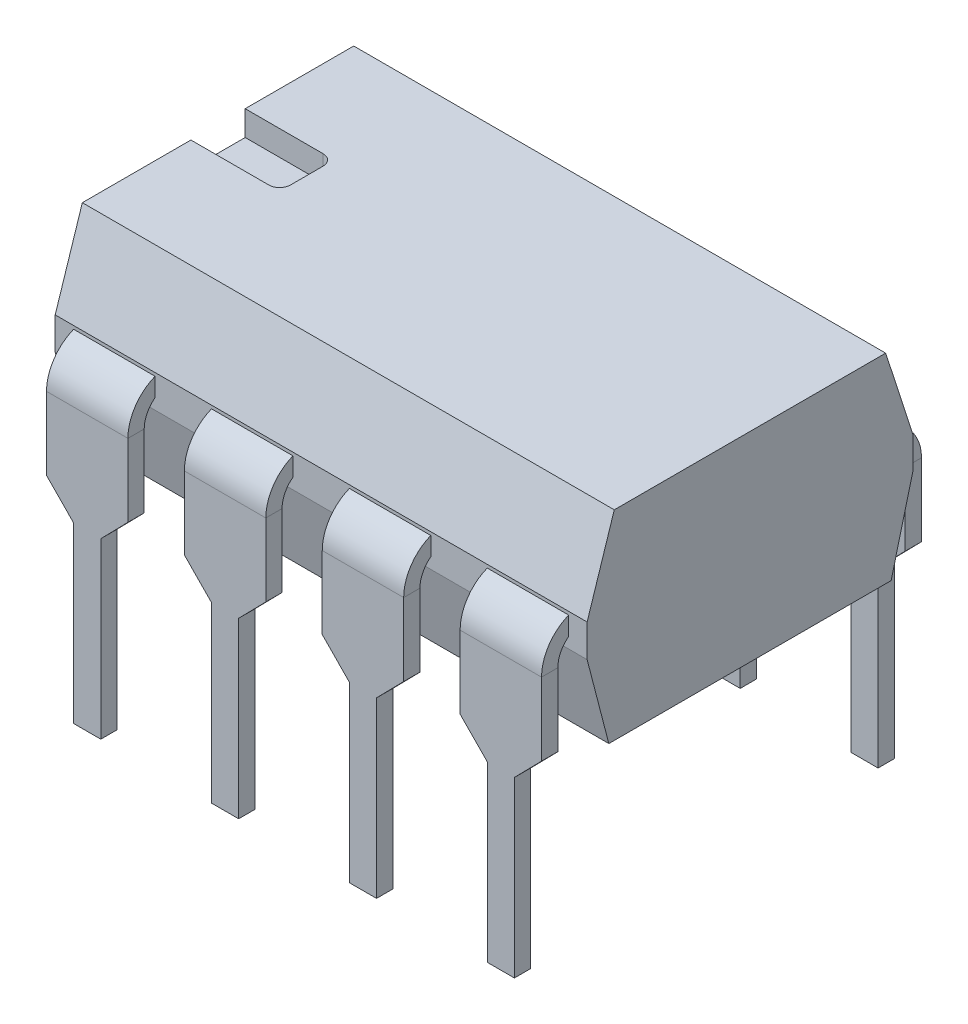
from build123d import *

# Parameters (mm, degrees)
BODY_FEATURE_DEPTH                    = 1.84
BODY_FEATURE_DEPTH_BACK               = 1.84
SKETCH1_W                             = 9.8
SKETCH1_H                             = 6
BEVEL_FEATURE_DEPTH                   = 9.8
BEVEL_FEATURE_DEPTH_BACK              = 9.8
SIGN_FEATURE_DEPTH                    = 0.46
FIRST_AND_LAST_PIN_FEATURE_DEPTH      = 0.75
FIRST_AND_LAST_PIN_FEATURE_DEPTH_BACK = 0.75
PIN_PROFILE_FEATURE_DEPTH             = 10
PIN_PROFILE_FEATURE_DEPTH_BACK        = 10
OTHER_PINS_FEATURE_COUNT              = 4
OTHER_PINS_FEATURE_PITCH              = 2.54


# Sheet-metal steps are written as plain solids
with BuildPart() as part:
    # Sketch1 → Body Feature (new, two sides: drawn at the far end of the back side and taken through both)
    with BuildSketch(Plane(origin=(0, 2.5, 0), x_dir=(1, 0, 0), z_dir=(0, 1, 0)).offset(-BODY_FEATURE_DEPTH_BACK)):
        with Locations((3.81, 3.5)):
            Rectangle(SKETCH1_W, SKETCH1_H)
    extrude(amount=BODY_FEATURE_DEPTH + BODY_FEATURE_DEPTH_BACK)

    # Sketch2 → Bevel Feature (cut, two sides: drawn at the far end of the back side and taken through both)
    with BuildSketch(Plane(origin=(0, 0, 0), x_dir=(0, 0, -1), z_dir=(1, 0, 0)).offset(-BEVEL_FEATURE_DEPTH_BACK)):
        Polygon((-9.5, 4.382711437), (-6.267114103, 14.34), (13.267114103, 14.34), (16.5, 4.382711437), (16.5, 0.922493794), (13.834417196, -9.34), (-6.834417196, -9.34), (-9.5, 0.922493794), align=None)
        Polygon((0.5, 2.8), (1, 4.34), (6, 4.34), (6.5, 2.8), (6.5, 2.2), (6.1, 0.66), (0.9, 0.66), (0.5, 2.2), align=None, mode=Mode.SUBTRACT)
    extrude(amount=BEVEL_FEATURE_DEPTH + BEVEL_FEATURE_DEPTH_BACK, mode=Mode.SUBTRACT)

    # Sketch3 → Sign Feature (cut)
    with BuildSketch(Plane(origin=(0, 4.34, 0), x_dir=(1, 0, 0), z_dir=(0, 1, 0))):
        with BuildLine():
            Line((-1.435, 4), (0.345, 4))
            ThreePointArc((0.345, 4), (0.486421356, 3.941421356), (0.545, 3.8))
            Line((0.545, 3.8), (0.545, 3.2))
            ThreePointArc((0.545, 3.2), (0.486421356, 3.058578644), (0.345, 3))
            Line((0.345, 3), (-1.435, 3))
            ThreePointArc((-1.435, 3), (-1.576421356, 3.058578644), (-1.635, 3.2))
            Line((-1.635, 3.2), (-1.635, 3.8))
            ThreePointArc((-1.635, 3.8), (-1.576421356, 3.941421356), (-1.435, 4))
        make_face()
    extrude(amount=-SIGN_FEATURE_DEPTH, mode=Mode.SUBTRACT)


with BuildPart() as body_2:
    # Sketch4 → First and Last Pin Feature (new, two sides: drawn at the far end of the back side and taken through both)
    with BuildSketch(Plane(origin=(0, 0, 0), x_dir=(0, 0, -1), z_dir=(1, 0, 0)).offset(-FIRST_AND_LAST_PIN_FEATURE_DEPTH_BACK)):
        with BuildLine():
            Line((0, -3.05), (0, 2))
            ThreePointArc((0, 2), (0.234314575, 2.565685425), (0.8, 2.8))
            Line((0.8, 2.8), (6.2, 2.8))
            ThreePointArc((6.2, 2.8), (6.765685425, 2.565685425), (7, 2))
            Line((7, 2), (7, -3.05))
            Line((7, -3.05), (6.7, -3.05))
            Line((6.7, -3.05), (6.7, 2))
            ThreePointArc((6.7, 2), (6.553553391, 2.353553391), (6.2, 2.5))
            Line((6.2, 2.5), (0.8, 2.5))
            ThreePointArc((0.8, 2.5), (0.446446609, 2.353553391), (0.3, 2))
            Line((0.3, 2), (0.3, -3.05))
            Line((0.3, -3.05), (0, -3.05))
        make_face()
    extrude(amount=FIRST_AND_LAST_PIN_FEATURE_DEPTH + FIRST_AND_LAST_PIN_FEATURE_DEPTH_BACK)

    # Sketch9 → Pin Profile Feature (cut, two sides: drawn at the far end of the back side and taken through both)
    with BuildSketch(Plane.XY.offset(-PIN_PROFILE_FEATURE_DEPTH_BACK)):
        Polygon((-0.25, -3.05), (-0.25, 0.15), (-0.75, 0.66), (-0.75, -4.05), (0.75, -4.05), (0.75, 0.66), (0.25, 0.15), (0.25, -3.05), align=None)
    extrude(amount=PIN_PROFILE_FEATURE_DEPTH + PIN_PROFILE_FEATURE_DEPTH_BACK, mode=Mode.SUBTRACT)


with BuildPart() as other_pins_feature_1:
    # Other Pins Feature: pattern copy
    add(body_2.part.moved(Location(Vector(1, 0, 0) * (1 * OTHER_PINS_FEATURE_PITCH))))


with BuildPart() as other_pins_feature_2:
    # Other Pins Feature: pattern copy
    add(body_2.part.moved(Location(Vector(1, 0, 0) * (2 * OTHER_PINS_FEATURE_PITCH))))


with BuildPart() as other_pins_feature_3:
    # Other Pins Feature: pattern copy
    add(body_2.part.moved(Location(Vector(1, 0, 0) * (3 * OTHER_PINS_FEATURE_PITCH))))


solid = Compound([part.part, body_2.part, other_pins_feature_1.part, other_pins_feature_2.part, other_pins_feature_3.part])
